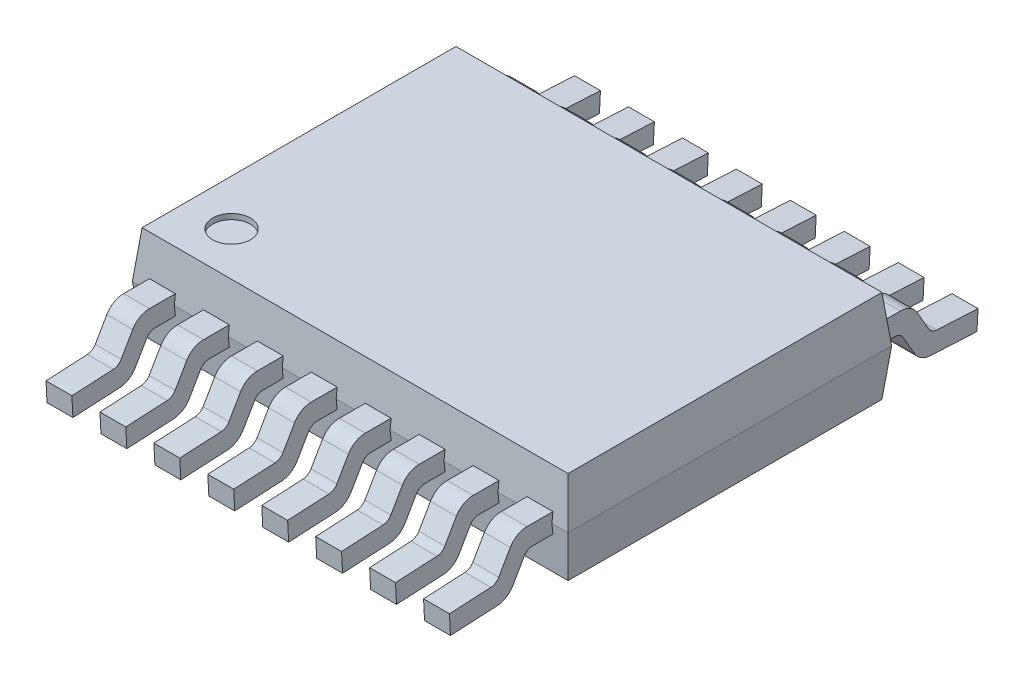
from build123d import *

# Parameters (mm, degrees)
EXTRUDE_START             = 0.53
SKETCH_2_W                = 4.039
SKETCH_2_H                = 3
EXTRUDE_3_DEPTH           = 0.43
EXTRUDE_3_TAPER           = 6
EXTRUDE_3_OTHER_WAY_DEPTH = 0.43
EXTRUDE_3_OTHER_WAY_TAPER = 6
EXTRUDE_4_DEPTH           = 0.12
EXTRUDE_4_2_DEPTH         = 0.12
PATTERN_START             = -1.87
PATTERN_LINEAR_1_DEPTH    = 0.24
PATTERN_START_2           = -1.37
PATTERN_LINEAR_1_2_DEPTH  = 0.24
PATTERN_START_3           = -0.87
PATTERN_LINEAR_1_3_DEPTH  = 0.24
PATTERN_START_4           = -0.37
PATTERN_LINEAR_1_4_DEPTH  = 0.24
PATTERN_START_5           = 0.63
PATTERN_LINEAR_1_5_DEPTH  = 0.24
PATTERN_START_6           = 1.13
PATTERN_LINEAR_1_6_DEPTH  = 0.24
PATTERN_START_7           = 1.63
PATTERN_LINEAR_1_7_DEPTH  = 0.24
SKETCH_3_R                = 0.175
CUT_EXTRUDE_1_DEPTH       = 0.05


# Read off the part's stored shape, not the designer's step: Линейный массив1
with BuildPart() as part:
    # Эскиз2 → Бобышка-Вытянуть3 (new body)
    with BuildSketch(Plane(origin=(0, 0, 0), x_dir=(1, 0, 0), z_dir=(0, 1, 0)).offset(EXTRUDE_START)):
        Rectangle(SKETCH_2_W, SKETCH_2_H)
    extrude(amount=EXTRUDE_3_DEPTH, taper=EXTRUDE_3_TAPER)

    # Эскиз2 → Бобышка-Вытянуть3 other way (add)
    with BuildSketch(Plane(origin=(0, 0, 0), x_dir=(1, 0, 0), z_dir=(0, 1, 0)).offset(EXTRUDE_START)):
        Rectangle(SKETCH_2_W, SKETCH_2_H)
    extrude(amount=-EXTRUDE_3_OTHER_WAY_DEPTH, taper=EXTRUDE_3_OTHER_WAY_TAPER)



with BuildPart() as body_2:
    # Эскиз17 → Бобышка-Вытянуть4 (new, symmetric)
    with BuildSketch(Plane(origin=(0.25, 0, -0.25), x_dir=(0, 0, 1), z_dir=(-1, 0, 0))):
        with BuildLine():
            Line((1.75, 0.53), (1.740540619, 0.62))
            Line((1.740540619, 0.62), (1.980316988, 0.62))
            ThreePointArc((1.980316988, 0.62), (2.070316988, 0.595884573), (2.136201561, 0.53))
            Line((2.136201561, 0.53), (2.243165081, 0.344733749))
            ThreePointArc((2.243165081, 0.344733749), (2.274082497, 0.312996134), (2.316397131, 0.299857091))
            Line((2.316397131, 0.299857091), (2.7, 0.279753316))
            Line((2.7, 0.279753316), (2.690579528, 0.1))
            Line((2.690579528, 0.1), (2.258177615, 0.122661224))
            ThreePointArc((2.258177615, 0.122661224), (2.173548346, 0.148939311), (2.111713515, 0.21241454))
            Line((2.111713515, 0.21241454), (2.006297751, 0.395))
            ThreePointArc((2.006297751, 0.395), (1.973355464, 0.427942286), (1.928355464, 0.44))
            Line((1.928355464, 0.44), (1.740540619, 0.44))
            Line((1.740540619, 0.44), (1.75, 0.53))
        make_face()
    extrude(amount=EXTRUDE_4_DEPTH, both=True)


with BuildPart() as body_3:
    # Эскиз17 → Extrude 4 2 (new, symmetric)
    with BuildSketch(Plane(origin=(0.25, 0, -0.25), x_dir=(0, 0, 1), z_dir=(-1, 0, 0))):
        with BuildLine():
            Line((-1.743165081, 0.344733749), (-1.636201561, 0.53))
            ThreePointArc((-1.636201561, 0.53), (-1.570316988, 0.595884573), (-1.480316988, 0.62))
            Line((-1.480316988, 0.62), (-1.240540619, 0.62))
            Line((-1.240540619, 0.62), (-1.25, 0.53))
            Line((-1.25, 0.53), (-1.240540619, 0.44))
            Line((-1.240540619, 0.44), (-1.428355464, 0.44))
            ThreePointArc((-1.428355464, 0.44), (-1.473355464, 0.427942286), (-1.506297751, 0.395))
            Line((-1.506297751, 0.395), (-1.611713515, 0.21241454))
            ThreePointArc((-1.611713515, 0.21241454), (-1.673548346, 0.148939311), (-1.758177615, 0.122661224))
            Line((-1.758177615, 0.122661224), (-2.190579528, 0.1))
            Line((-2.190579528, 0.1), (-2.2, 0.279753316))
            Line((-2.2, 0.279753316), (-1.816397131, 0.299857091))
            ThreePointArc((-1.816397131, 0.299857091), (-1.774082497, 0.312996134), (-1.743165081, 0.344733749))
        make_face()
    extrude(amount=EXTRUDE_4_2_DEPTH, both=True)


with BuildPart() as part_1:
    add(part.part)

    add(body_2.part)  # Линейный массив1 merges body 2

    add(body_3.part)  # Линейный массив1 merges body 3
    # Линейный массив1 outline → Линейный массив1 (add)
    with BuildSketch(Plane.YZ.offset(PATTERN_START)):
        with BuildLine():
            Line((0.53, 1.5), (0.62, 1.490540619))
            Line((0.62, 1.490540619), (0.62, 1.730316988))
            ThreePointArc((0.62, 1.730316988), (0.595884573, 1.820316988), (0.53, 1.886201561))
            Line((0.53, 1.886201561), (0.344733749, 1.993165081))
            ThreePointArc((0.344733749, 1.993165081), (0.312996134, 2.024082496), (0.299857091, 2.066397131))
            Line((0.299857091, 2.066397131), (0.279753316, 2.45))
            Line((0.279753316, 2.45), (0.1, 2.440579528))
            Line((0.1, 2.440579528), (0.122661224, 2.008177615))
            ThreePointArc((0.122661224, 2.008177615), (0.148939311, 1.923548346), (0.21241454, 1.861713515))
            Line((0.21241454, 1.861713515), (0.395, 1.756297751))
            ThreePointArc((0.395, 1.756297751), (0.427942286, 1.723355464), (0.44, 1.678355464))
            Line((0.44, 1.678355464), (0.44, 1.490540619))
            Line((0.44, 1.490540619), (0.53, 1.5))
        make_face()
        with BuildLine():
            ThreePointArc((0.53, -1.886201561), (0.595884573, -1.820316988), (0.62, -1.730316988))
            Line((0.62, -1.730316988), (0.62, -1.490540619))
            Line((0.62, -1.490540619), (0.53, -1.5))
            Line((0.53, -1.5), (0.44, -1.490540619))
            Line((0.44, -1.490540619), (0.44, -1.678355464))
            ThreePointArc((0.44, -1.678355464), (0.427942286, -1.723355464), (0.395, -1.756297751))
            Line((0.395, -1.756297751), (0.21241454, -1.861713515))
            ThreePointArc((0.21241454, -1.861713515), (0.148939311, -1.923548346), (0.122661224, -2.008177615))
            Line((0.122661224, -2.008177615), (0.1, -2.440579528))
            Line((0.1, -2.440579528), (0.279753316, -2.45))
            Line((0.279753316, -2.45), (0.299857091, -2.066397131))
            ThreePointArc((0.299857091, -2.066397131), (0.312996134, -2.024082496), (0.344733749, -1.993165081))
            Line((0.344733749, -1.993165081), (0.53, -1.886201561))
        make_face()
    extrude(amount=PATTERN_LINEAR_1_DEPTH)

    # Pattern Linear 1 2 outline → Pattern Linear 1 2 (add)
    with BuildSketch(Plane.YZ.offset(PATTERN_START_2)):
        with BuildLine():
            Line((0.53, 1.5), (0.62, 1.490540619))
            Line((0.62, 1.490540619), (0.62, 1.730316988))
            ThreePointArc((0.62, 1.730316988), (0.595884573, 1.820316988), (0.53, 1.886201561))
            Line((0.53, 1.886201561), (0.344733749, 1.993165081))
            ThreePointArc((0.344733749, 1.993165081), (0.312996134, 2.024082496), (0.299857091, 2.066397131))
            Line((0.299857091, 2.066397131), (0.279753316, 2.45))
            Line((0.279753316, 2.45), (0.1, 2.440579528))
            Line((0.1, 2.440579528), (0.122661224, 2.008177615))
            ThreePointArc((0.122661224, 2.008177615), (0.148939311, 1.923548346), (0.21241454, 1.861713515))
            Line((0.21241454, 1.861713515), (0.395, 1.756297751))
            ThreePointArc((0.395, 1.756297751), (0.427942286, 1.723355464), (0.44, 1.678355464))
            Line((0.44, 1.678355464), (0.44, 1.490540619))
            Line((0.44, 1.490540619), (0.53, 1.5))
        make_face()
        with BuildLine():
            ThreePointArc((0.53, -1.886201561), (0.595884573, -1.820316988), (0.62, -1.730316988))
            Line((0.62, -1.730316988), (0.62, -1.490540619))
            Line((0.62, -1.490540619), (0.53, -1.5))
            Line((0.53, -1.5), (0.44, -1.490540619))
            Line((0.44, -1.490540619), (0.44, -1.678355464))
            ThreePointArc((0.44, -1.678355464), (0.427942286, -1.723355464), (0.395, -1.756297751))
            Line((0.395, -1.756297751), (0.21241454, -1.861713515))
            ThreePointArc((0.21241454, -1.861713515), (0.148939311, -1.923548346), (0.122661224, -2.008177615))
            Line((0.122661224, -2.008177615), (0.1, -2.440579528))
            Line((0.1, -2.440579528), (0.279753316, -2.45))
            Line((0.279753316, -2.45), (0.299857091, -2.066397131))
            ThreePointArc((0.299857091, -2.066397131), (0.312996134, -2.024082496), (0.344733749, -1.993165081))
            Line((0.344733749, -1.993165081), (0.53, -1.886201561))
        make_face()
    extrude(amount=PATTERN_LINEAR_1_2_DEPTH)

    # Pattern Linear 1 3 outline → Pattern Linear 1 3 (add)
    with BuildSketch(Plane.YZ.offset(PATTERN_START_3)):
        with BuildLine():
            Line((0.53, 1.5), (0.62, 1.490540619))
            Line((0.62, 1.490540619), (0.62, 1.730316988))
            ThreePointArc((0.62, 1.730316988), (0.595884573, 1.820316988), (0.53, 1.886201561))
            Line((0.53, 1.886201561), (0.344733749, 1.993165081))
            ThreePointArc((0.344733749, 1.993165081), (0.312996134, 2.024082496), (0.299857091, 2.066397131))
            Line((0.299857091, 2.066397131), (0.279753316, 2.45))
            Line((0.279753316, 2.45), (0.1, 2.440579528))
            Line((0.1, 2.440579528), (0.122661224, 2.008177615))
            ThreePointArc((0.122661224, 2.008177615), (0.148939311, 1.923548346), (0.21241454, 1.861713515))
            Line((0.21241454, 1.861713515), (0.395, 1.756297751))
            ThreePointArc((0.395, 1.756297751), (0.427942286, 1.723355464), (0.44, 1.678355464))
            Line((0.44, 1.678355464), (0.44, 1.490540619))
            Line((0.44, 1.490540619), (0.53, 1.5))
        make_face()
        with BuildLine():
            ThreePointArc((0.53, -1.886201561), (0.595884573, -1.820316988), (0.62, -1.730316988))
            Line((0.62, -1.730316988), (0.62, -1.490540619))
            Line((0.62, -1.490540619), (0.53, -1.5))
            Line((0.53, -1.5), (0.44, -1.490540619))
            Line((0.44, -1.490540619), (0.44, -1.678355464))
            ThreePointArc((0.44, -1.678355464), (0.427942286, -1.723355464), (0.395, -1.756297751))
            Line((0.395, -1.756297751), (0.21241454, -1.861713515))
            ThreePointArc((0.21241454, -1.861713515), (0.148939311, -1.923548346), (0.122661224, -2.008177615))
            Line((0.122661224, -2.008177615), (0.1, -2.440579528))
            Line((0.1, -2.440579528), (0.279753316, -2.45))
            Line((0.279753316, -2.45), (0.299857091, -2.066397131))
            ThreePointArc((0.299857091, -2.066397131), (0.312996134, -2.024082496), (0.344733749, -1.993165081))
            Line((0.344733749, -1.993165081), (0.53, -1.886201561))
        make_face()
    extrude(amount=PATTERN_LINEAR_1_3_DEPTH)

    # Pattern Linear 1 4 outline → Pattern Linear 1 4 (add)
    with BuildSketch(Plane.YZ.offset(PATTERN_START_4)):
        with BuildLine():
            Line((0.53, 1.5), (0.62, 1.490540619))
            Line((0.62, 1.490540619), (0.62, 1.730316988))
            ThreePointArc((0.62, 1.730316988), (0.595884573, 1.820316988), (0.53, 1.886201561))
            Line((0.53, 1.886201561), (0.344733749, 1.993165081))
            ThreePointArc((0.344733749, 1.993165081), (0.312996134, 2.024082496), (0.299857091, 2.066397131))
            Line((0.299857091, 2.066397131), (0.279753316, 2.45))
            Line((0.279753316, 2.45), (0.1, 2.440579528))
            Line((0.1, 2.440579528), (0.122661224, 2.008177615))
            ThreePointArc((0.122661224, 2.008177615), (0.148939311, 1.923548346), (0.21241454, 1.861713515))
            Line((0.21241454, 1.861713515), (0.395, 1.756297751))
            ThreePointArc((0.395, 1.756297751), (0.427942286, 1.723355464), (0.44, 1.678355464))
            Line((0.44, 1.678355464), (0.44, 1.490540619))
            Line((0.44, 1.490540619), (0.53, 1.5))
        make_face()
        with BuildLine():
            ThreePointArc((0.53, -1.886201561), (0.595884573, -1.820316988), (0.62, -1.730316988))
            Line((0.62, -1.730316988), (0.62, -1.490540619))
            Line((0.62, -1.490540619), (0.53, -1.5))
            Line((0.53, -1.5), (0.44, -1.490540619))
            Line((0.44, -1.490540619), (0.44, -1.678355464))
            ThreePointArc((0.44, -1.678355464), (0.427942286, -1.723355464), (0.395, -1.756297751))
            Line((0.395, -1.756297751), (0.21241454, -1.861713515))
            ThreePointArc((0.21241454, -1.861713515), (0.148939311, -1.923548346), (0.122661224, -2.008177615))
            Line((0.122661224, -2.008177615), (0.1, -2.440579528))
            Line((0.1, -2.440579528), (0.279753316, -2.45))
            Line((0.279753316, -2.45), (0.299857091, -2.066397131))
            ThreePointArc((0.299857091, -2.066397131), (0.312996134, -2.024082496), (0.344733749, -1.993165081))
            Line((0.344733749, -1.993165081), (0.53, -1.886201561))
        make_face()
    extrude(amount=PATTERN_LINEAR_1_4_DEPTH)

    # Pattern Linear 1 5 outline → Pattern Linear 1 5 (add)
    with BuildSketch(Plane.YZ.offset(PATTERN_START_5)):
        with BuildLine():
            Line((0.53, 1.5), (0.62, 1.490540619))
            Line((0.62, 1.490540619), (0.62, 1.730316988))
            ThreePointArc((0.62, 1.730316988), (0.595884573, 1.820316988), (0.53, 1.886201561))
            Line((0.53, 1.886201561), (0.344733749, 1.993165081))
            ThreePointArc((0.344733749, 1.993165081), (0.312996134, 2.024082496), (0.299857091, 2.066397131))
            Line((0.299857091, 2.066397131), (0.279753316, 2.45))
            Line((0.279753316, 2.45), (0.1, 2.440579528))
            Line((0.1, 2.440579528), (0.122661224, 2.008177615))
            ThreePointArc((0.122661224, 2.008177615), (0.148939311, 1.923548346), (0.21241454, 1.861713515))
            Line((0.21241454, 1.861713515), (0.395, 1.756297751))
            ThreePointArc((0.395, 1.756297751), (0.427942286, 1.723355464), (0.44, 1.678355464))
            Line((0.44, 1.678355464), (0.44, 1.490540619))
            Line((0.44, 1.490540619), (0.53, 1.5))
        make_face()
        with BuildLine():
            ThreePointArc((0.53, -1.886201561), (0.595884573, -1.820316988), (0.62, -1.730316988))
            Line((0.62, -1.730316988), (0.62, -1.490540619))
            Line((0.62, -1.490540619), (0.53, -1.5))
            Line((0.53, -1.5), (0.44, -1.490540619))
            Line((0.44, -1.490540619), (0.44, -1.678355464))
            ThreePointArc((0.44, -1.678355464), (0.427942286, -1.723355464), (0.395, -1.756297751))
            Line((0.395, -1.756297751), (0.21241454, -1.861713515))
            ThreePointArc((0.21241454, -1.861713515), (0.148939311, -1.923548346), (0.122661224, -2.008177615))
            Line((0.122661224, -2.008177615), (0.1, -2.440579528))
            Line((0.1, -2.440579528), (0.279753316, -2.45))
            Line((0.279753316, -2.45), (0.299857091, -2.066397131))
            ThreePointArc((0.299857091, -2.066397131), (0.312996134, -2.024082496), (0.344733749, -1.993165081))
            Line((0.344733749, -1.993165081), (0.53, -1.886201561))
        make_face()
    extrude(amount=PATTERN_LINEAR_1_5_DEPTH)

    # Pattern Linear 1 6 outline → Pattern Linear 1 6 (add)
    with BuildSketch(Plane.YZ.offset(PATTERN_START_6)):
        with BuildLine():
            Line((0.53, 1.5), (0.62, 1.490540619))
            Line((0.62, 1.490540619), (0.62, 1.730316988))
            ThreePointArc((0.62, 1.730316988), (0.595884573, 1.820316988), (0.53, 1.886201561))
            Line((0.53, 1.886201561), (0.344733749, 1.993165081))
            ThreePointArc((0.344733749, 1.993165081), (0.312996134, 2.024082496), (0.299857091, 2.066397131))
            Line((0.299857091, 2.066397131), (0.279753316, 2.45))
            Line((0.279753316, 2.45), (0.1, 2.440579528))
            Line((0.1, 2.440579528), (0.122661224, 2.008177615))
            ThreePointArc((0.122661224, 2.008177615), (0.148939311, 1.923548346), (0.21241454, 1.861713515))
            Line((0.21241454, 1.861713515), (0.395, 1.756297751))
            ThreePointArc((0.395, 1.756297751), (0.427942286, 1.723355464), (0.44, 1.678355464))
            Line((0.44, 1.678355464), (0.44, 1.490540619))
            Line((0.44, 1.490540619), (0.53, 1.5))
        make_face()
        with BuildLine():
            ThreePointArc((0.53, -1.886201561), (0.595884573, -1.820316988), (0.62, -1.730316988))
            Line((0.62, -1.730316988), (0.62, -1.490540619))
            Line((0.62, -1.490540619), (0.53, -1.5))
            Line((0.53, -1.5), (0.44, -1.490540619))
            Line((0.44, -1.490540619), (0.44, -1.678355464))
            ThreePointArc((0.44, -1.678355464), (0.427942286, -1.723355464), (0.395, -1.756297751))
            Line((0.395, -1.756297751), (0.21241454, -1.861713515))
            ThreePointArc((0.21241454, -1.861713515), (0.148939311, -1.923548346), (0.122661224, -2.008177615))
            Line((0.122661224, -2.008177615), (0.1, -2.440579528))
            Line((0.1, -2.440579528), (0.279753316, -2.45))
            Line((0.279753316, -2.45), (0.299857091, -2.066397131))
            ThreePointArc((0.299857091, -2.066397131), (0.312996134, -2.024082496), (0.344733749, -1.993165081))
            Line((0.344733749, -1.993165081), (0.53, -1.886201561))
        make_face()
    extrude(amount=PATTERN_LINEAR_1_6_DEPTH)

    # Pattern Linear 1 7 outline → Pattern Linear 1 7 (add)
    with BuildSketch(Plane.YZ.offset(PATTERN_START_7)):
        with BuildLine():
            Line((0.53, 1.5), (0.62, 1.490540619))
            Line((0.62, 1.490540619), (0.62, 1.730316988))
            ThreePointArc((0.62, 1.730316988), (0.595884573, 1.820316988), (0.53, 1.886201561))
            Line((0.53, 1.886201561), (0.344733749, 1.993165081))
            ThreePointArc((0.344733749, 1.993165081), (0.312996134, 2.024082496), (0.299857091, 2.066397131))
            Line((0.299857091, 2.066397131), (0.279753316, 2.45))
            Line((0.279753316, 2.45), (0.1, 2.440579528))
            Line((0.1, 2.440579528), (0.122661224, 2.008177615))
            ThreePointArc((0.122661224, 2.008177615), (0.148939311, 1.923548346), (0.21241454, 1.861713515))
            Line((0.21241454, 1.861713515), (0.395, 1.756297751))
            ThreePointArc((0.395, 1.756297751), (0.427942286, 1.723355464), (0.44, 1.678355464))
            Line((0.44, 1.678355464), (0.44, 1.490540619))
            Line((0.44, 1.490540619), (0.53, 1.5))
        make_face()
        with BuildLine():
            ThreePointArc((0.53, -1.886201561), (0.595884573, -1.820316988), (0.62, -1.730316988))
            Line((0.62, -1.730316988), (0.62, -1.490540619))
            Line((0.62, -1.490540619), (0.53, -1.5))
            Line((0.53, -1.5), (0.44, -1.490540619))
            Line((0.44, -1.490540619), (0.44, -1.678355464))
            ThreePointArc((0.44, -1.678355464), (0.427942286, -1.723355464), (0.395, -1.756297751))
            Line((0.395, -1.756297751), (0.21241454, -1.861713515))
            ThreePointArc((0.21241454, -1.861713515), (0.148939311, -1.923548346), (0.122661224, -2.008177615))
            Line((0.122661224, -2.008177615), (0.1, -2.440579528))
            Line((0.1, -2.440579528), (0.279753316, -2.45))
            Line((0.279753316, -2.45), (0.299857091, -2.066397131))
            ThreePointArc((0.299857091, -2.066397131), (0.312996134, -2.024082496), (0.344733749, -1.993165081))
            Line((0.344733749, -1.993165081), (0.53, -1.886201561))
        make_face()
    extrude(amount=PATTERN_LINEAR_1_7_DEPTH)

    # Эскиз3 → Вырез-Вытянуть1 (cut)
    with BuildSketch(Plane(origin=(0, 0.96, 0.96), x_dir=(1, 0, 0), z_dir=(0, 1, 0))):
        with Locations(Location((-1.55, -0.09, 0), (0, 0, 270))):
            Circle(SKETCH_3_R)
    extrude(amount=-CUT_EXTRUDE_1_DEPTH, mode=Mode.SUBTRACT)


solid = part_1.part
